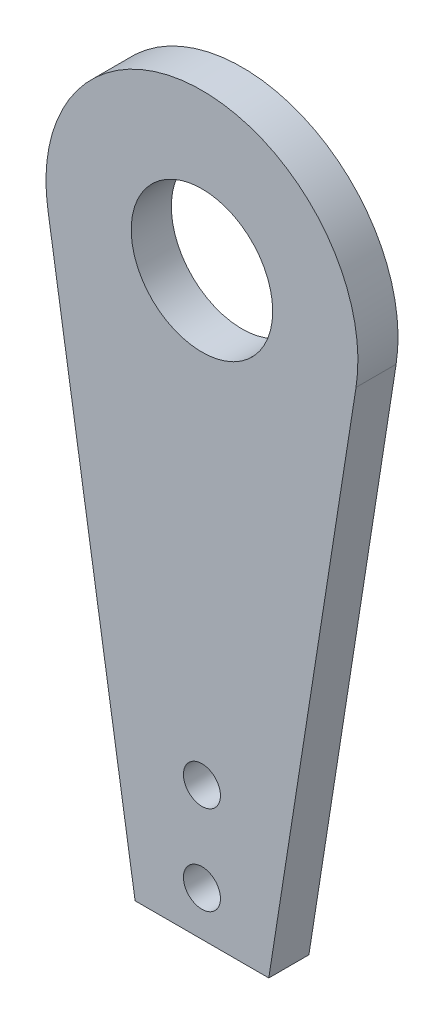
from build123d import *

# Parameters (mm, degrees)
SKETCH1_R           = 2.075
SKETCH1_R_2         = 7.9375
BOSS_EXTRUDE2_DEPTH = 4.5


with BuildPart() as part:
    # Sketch1 → Boss-Extrude2 (new body)
    with BuildSketch(Plane.XY):
        with BuildLine():
            Line((-7.5, -5), (7.5, -5))
            Line((7.5, -5), (17.287829772, 57.283211128))
            ThreePointArc((17.287829772, 57.283211128), (0, 77.5), (-17.287829772, 57.283211128))
            Line((-17.287829772, 57.283211128), (-7.5, -5))
        make_face()
        Circle(SKETCH1_R, mode=Mode.SUBTRACT)
        with Locations((0, 60)):
            Circle(SKETCH1_R_2, mode=Mode.SUBTRACT)
        with Locations((0, 10)):
            Circle(SKETCH1_R, mode=Mode.SUBTRACT)
    extrude(amount=BOSS_EXTRUDE2_DEPTH)


solid = part.part
